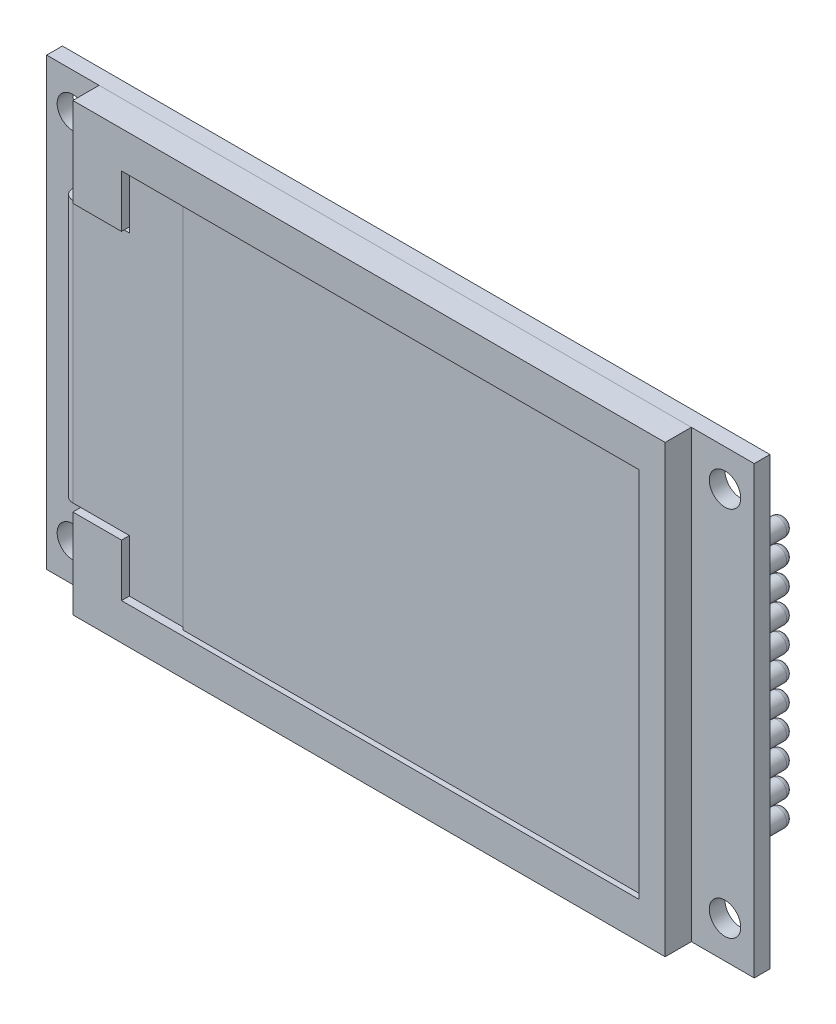
from build123d import *

# Parameters (mm, degrees)
SKETCH2_W           = 67.5
SKETCH2_H           = 42.5
BOSS_EXTRUDE1_DEPTH = 1.5
SKETCH3_R           = 1.5
CUT_EXTRUDE1_DEPTH  = 40.910838127
SKETCH4_W           = 56.5
SKETCH4_H           = 42.5
BOSS_EXTRUDE2_DEPTH = 2.5
SKETCH5_W           = 44
SKETCH5_H           = 35.5
CUT_EXTRUDE2_DEPTH  = 0.5
CUT_EXTRUDE3_DEPTH  = 1.5
BOSS_EXTRUDE3_DEPTH = 1
FILLET1_R           = 1
BOSS_EXTRUDE4_DEPTH = 3
SHELL1_T            = -0.4
SKETCH9_W           = 2.71
SKETCH9_H           = 27.5
BOSS_EXTRUDE5_DEPTH = 1
SKETCH10_R          = 0.85
BOSS_EXTRUDE6_DEPTH = 3
FILLET2_R           = 0.6


with BuildPart() as part:
    # Sketch2 → Boss-Extrude1 (new body)
    with BuildSketch(Plane.XY):
        Rectangle(SKETCH2_W, SKETCH2_H)
    extrude(amount=BOSS_EXTRUDE1_DEPTH)

    # Sketch3 → Cut-Extrude1 (cut, through all)
    with BuildSketch(Plane.XY.offset(1.5)):
        with Locations((-31.25, 17.75)):
            Circle(SKETCH3_R)
        with Locations((30.96, 17.75)):
            Circle(SKETCH3_R)
        with Locations((-31.25, -17.71)):
            Circle(SKETCH3_R)
        with Locations((30.96, -17.71)):
            Circle(SKETCH3_R)
    extrude(amount=-CUT_EXTRUDE1_DEPTH, mode=Mode.SUBTRACT)


with BuildPart() as body_2:
    # Sketch4 → Boss-Extrude2 (new body)
    with BuildSketch(Plane.XY.offset(1.5)):
        with Locations((-0.5, 0)):
            Rectangle(SKETCH4_W, SKETCH4_H)
    extrude(amount=BOSS_EXTRUDE2_DEPTH)

    # Sketch5 → Cut-Extrude2 (cut)
    with BuildSketch(Plane.XY.offset(4)):
        with Locations((3.25, 0)):
            Rectangle(SKETCH5_W, SKETCH5_H)
    extrude(amount=-CUT_EXTRUDE2_DEPTH, mode=Mode.SUBTRACT)

    # Sketch6 → Cut-Extrude3 (cut)
    with BuildSketch(Plane.XY.offset(4)):
        Polygon((-18.75, 17.75), (-24.109667547, 17.75), (-24.109667547, 12.75), (-28.75, 12.75), (-28.75, -12.75), (-24.109667547, -12.75), (-24.109667547, -17.75), (-18.75, -17.75), align=None)
    extrude(amount=-CUT_EXTRUDE3_DEPTH, mode=Mode.SUBTRACT)


with BuildPart() as body_3:
    # Sketch7 → Boss-Extrude3 (new body)
    with BuildSketch(Plane.XY.offset(2.5)):
        Polygon((-18.75, 17.5), (-23.859667547, 17.5), (-23.859667547, 12.5), (-30.25, 12.5), (-30.25, -12.5), (-23.859667547, -12.5), (-23.859667547, -17.5), (-18.75, -17.5), align=None)
    extrude(amount=BOSS_EXTRUDE3_DEPTH)

    # Fillet1
    fillet1_edges = [body_3.edges().sort_by_distance(p)[0] for p in [
        (-30.25, 0, 3.5),
    ]]
    fillet(fillet1_edges, radius=FILLET1_R - 0.0001)  # a hair under: the kernel refuses the full size


with BuildPart() as body_4:
    # Sketch8 → Boss-Extrude4 (new body)
    with BuildSketch(Plane(origin=(0, 0, 0), x_dir=(-1, 0, 0), z_dir=(0, 0, -1))):
        Polygon((18.75, -21.25), (-7.25, -21.25), (-7.25, -4.25), (15.75, -4.25), (15.75, -8.474887062), (18.75, -11.39658587), align=None)
    extrude(amount=BOSS_EXTRUDE4_DEPTH)

    # Shell1
    shell1_openings = [body_4.faces().sort_by_distance(p)[0] for p in [
        (-5.75, -21.25, -1.5),
    ]]
    offset(amount=SHELL1_T, openings=shell1_openings, kind=Kind.INTERSECTION)


with BuildPart() as body_5:
    # Sketch9 → Boss-Extrude5 (new body)
    with BuildSketch(Plane(origin=(0, 0, 0), x_dir=(-1, 0, 0), z_dir=(0, 0, -1))):
        with Locations((-31.105, 0)):
            Rectangle(SKETCH9_W, SKETCH9_H)
    extrude(amount=BOSS_EXTRUDE5_DEPTH)

    # Sketch10 → Boss-Extrude6 (add)
    with BuildSketch(Plane(origin=(0, 0, -1), x_dir=(-1, 0, 0), z_dir=(0, 0, -1))):
        with Locations(Location((-31.1, 12.25, 0), (0, 0, 180))):
            Circle(SKETCH10_R)
        with Locations(Location((-31.1, 9.85, 0), (0, 0, 180))):
            Circle(SKETCH10_R)
        with Locations(Location((-31.1, 7.45, 0), (0, 0, 180))):
            Circle(SKETCH10_R)
        with Locations(Location((-31.1, 5.05, 0), (0, 0, 180))):
            Circle(SKETCH10_R)
        with Locations(Location((-31.1, 2.65, 0), (0, 0, 180))):
            Circle(SKETCH10_R)
        with Locations(Location((-31.1, 0.25, 0), (0, 0, 180))):
            Circle(SKETCH10_R)
        with Locations(Location((-31.1, -2.15, 0), (0, 0, 180))):
            Circle(SKETCH10_R)
        with Locations(Location((-31.1, -4.55, 0), (0, 0, 180))):
            Circle(SKETCH10_R)
        with Locations(Location((-31.1, -6.95, 0), (0, 0, 180))):
            Circle(SKETCH10_R)
        with Locations(Location((-31.1, -9.35, 0), (0, 0, 180))):
            Circle(SKETCH10_R)
        with Locations(Location((-31.1, -11.75, 0), (0, 0, 180))):
            Circle(SKETCH10_R)
    extrude(amount=BOSS_EXTRUDE6_DEPTH)

    # Fillet2
    fillet2_edges = [body_5.edges().sort_by_distance(p)[0] for p in [
        (30.25, 12.25, -4),
        (30.25, 9.85, -4),
        (30.25, 7.45, -4),
        (30.25, 5.05, -4),
        (30.25, 2.65, -4),
        (30.25, 0.25, -4),
        (30.25, -2.15, -4),
        (30.25, -4.55, -4),
        (30.25, -6.95, -4),
        (30.25, -9.35, -4),
        (30.25, -11.75, -4),
    ]]
    fillet(fillet2_edges, radius=FILLET2_R)


solid = Compound([part.part, body_2.part, body_3.part, body_4.part, body_5.part])
